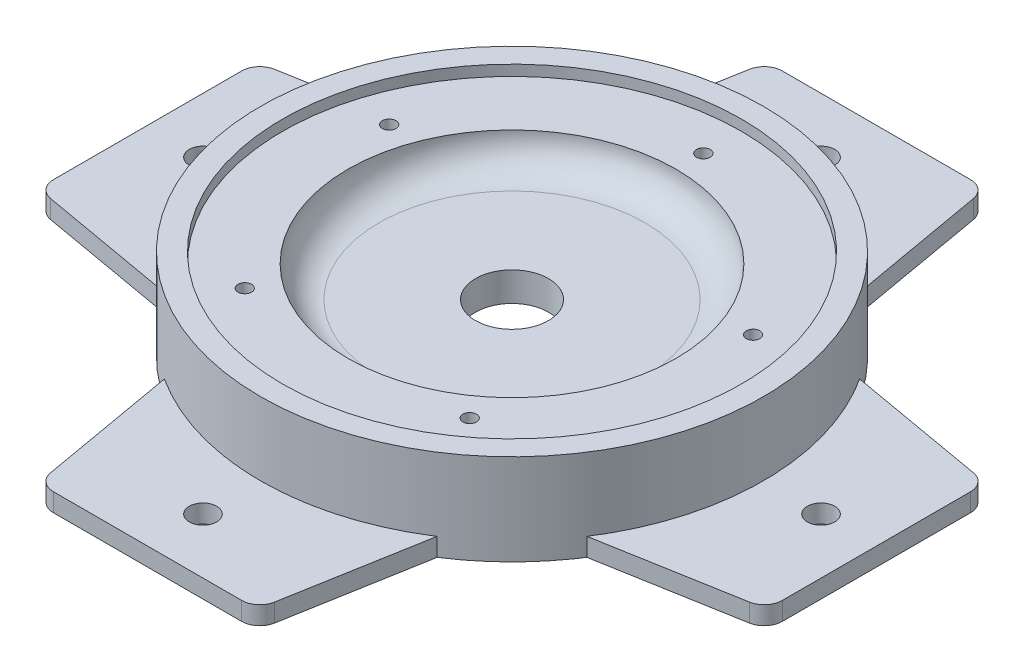
from build123d import *

# Parameters (mm, degrees)
F_3_16_0_187_DIAMETER_HOLE1_AT_2_COUNT = 2
F_3_16_0_187_DIAMETER_HOLE1_AT_2_PITCH = 181.676687383
CIRPATTERN2_COUNT                      = 5
F_1_1_DIAMETER_HOLE1_D                 = 25.4
BOSS_EXTRUDE1_DEPTH                    = 6.35
FILLET2_R                              = 6.35
CIRPATTERN4_COUNT                      = 4
FILLET3_R                              = 10.795


with BuildPart() as part:
    # Sketch1 → Revolve1 (revolve)
    with BuildSketch(Plane.XY, mode=Mode.PRIVATE) as revolve1_sk:
        Polygon((87.63, -7.0866), (87.63, 24.6634), (79.9846, 24.6634), (79.9846, 20.955), (57.15, 20.955), (57.15, 10.16), (0, 10.16), (0, 0), (57.15, 0), (57.15, -7.0866), align=None)
    revolve(revolve1_sk.sketch.rotate(Axis((0, 92.596818824, 0), (0, -1, 0)), 90), axis=Axis((0, 92.596818824, 0), (0, -1, 0)))

    # Sketch6 → 3/16 (0.187) Diameter Hole1 (revolve, cut)
    with BuildSketch(Plane(origin=(0, 24.6634, -66.675), x_dir=(0, 0, 1), z_dir=(1, 0, 0))):
        Polygon((0, 0), (0, 11.078983884), (2.3749, 9.652), (2.3749, 0), align=None)
    f_3_16_0_187_diameter_hole1 = revolve(axis=Axis((0, 31.0134, -66.675), (0, -1, 0)), mode=Mode.SUBTRACT)

    # 3/16 (0.187) Diameter Hole1 at 2: 3/16 (0.187) Diameter Hole1 ×2
    with Locations(*[Vector(-0.6277965872660483, 0, 0.778377443800309) * (i * F_3_16_0_187_DIAMETER_HOLE1_AT_2_PITCH) for i in range(1, F_3_16_0_187_DIAMETER_HOLE1_AT_2_COUNT)]):
        add(f_3_16_0_187_diameter_hole1, mode=Mode.SUBTRACT)

    # CirPattern2: 3/16 (0.187) Diameter Hole1 ×5 about axis
    cirpattern2_axis = Axis((0, 0, 0), (0, 1, 0))
    for i in range(1, CIRPATTERN2_COUNT):
        add(f_3_16_0_187_diameter_hole1.rotate(cirpattern2_axis, i * 360 / CIRPATTERN2_COUNT), mode=Mode.SUBTRACT)

    # CirPattern2 copy 1 sketch → CirPattern2 copy 1 (revolve, cut)
    with BuildSketch(Plane(origin=(35.834852053, 24.6634, 131.569029239), x_dir=(0.9510565162951535, 0, 0.30901699437494745), z_dir=(0.30901699437494745, 0, -0.9510565162951535))):
        Polygon((0, 0), (0, 11.078983884), (2.3749, 9.652), (2.3749, 0), align=None)
    revolve(axis=Axis((35.834852053, 31.0134, 131.569029239), (0, -1, 0)), mode=Mode.SUBTRACT)

    # CirPattern2 copy 2 sketch → CirPattern2 copy 2 (revolve, cut)
    with BuildSketch(Plane(origin=(136.203160876, 24.6634, 6.576096413), x_dir=(0.5877852522924732, 0, -0.8090169943749473), z_dir=(-0.8090169943749473, 0, -0.5877852522924732))):
        Polygon((0, 0), (0, 11.078983884), (2.3749, 9.652), (2.3749, 0), align=None)
    revolve(axis=Axis((136.203160876, 31.0134, 6.576096413), (0, -1, 0)), mode=Mode.SUBTRACT)

    # CirPattern2 copy 3 sketch → CirPattern2 copy 3 (revolve, cut)
    with BuildSketch(Plane(origin=(48.343330743, 24.6634, -127.504778142), x_dir=(-0.587785252292473, 0, -0.8090169943749476), z_dir=(-0.8090169943749476, 0, 0.587785252292473))):
        Polygon((0, 0), (0, 11.078983884), (2.3749, 9.652), (2.3749, 0), align=None)
    revolve(axis=Axis((48.343330743, 31.0134, -127.504778142), (0, -1, 0)), mode=Mode.SUBTRACT)

    # CirPattern2 copy 4 sketch → CirPattern2 copy 4 (revolve, cut)
    with BuildSketch(Plane(origin=(-106.325339347, 24.6634, -85.378383033), x_dir=(-0.9510565162951536, 0, 0.30901699437494723), z_dir=(0.30901699437494723, 0, 0.9510565162951536))):
        Polygon((0, 0), (0, 11.078983884), (2.3749, 9.652), (2.3749, 0), align=None)
    revolve(axis=Axis((-106.325339347, 31.0134, -85.378383033), (0, -1, 0)), mode=Mode.SUBTRACT)

    # 1 (1) Diameter Hole1 (through all)
    with Locations(Plane(origin=(0, 10.16, 0), x_dir=(1, 0, 0), z_dir=(0, 1, 0))):
        with Locations((0, 0)):
            Hole(F_1_1_DIAMETER_HOLE1_D / 2)

    # Fillet3
    # the kernel refuses this fillet: 10.795 mm, written as the material it adds along each edge
    with BuildSketch(Plane(origin=(0, 10.16, 0), x_dir=(0, 0, 1), z_dir=(1, 0, 0))) as fillet3_piece_1:
        with BuildLine():
            CenterArc((57.15 - FILLET3_R, -FILLET3_R), FILLET3_R, 0, 90)
            Line((57.15 - FILLET3_R, 0), (57.15 - FILLET3_R, FILLET3_R * 0.02))
            Line((57.15 - FILLET3_R, FILLET3_R * 0.02), (57.15 + FILLET3_R * 0.02, FILLET3_R * 0.02))
            Line((57.15 + FILLET3_R * 0.02, FILLET3_R * 0.02), (57.15 + FILLET3_R * 0.02, -FILLET3_R))
            Line((57.15 + FILLET3_R * 0.02, -FILLET3_R), (57.15, -FILLET3_R))
        make_face()
    revolve(axis=Axis((0, 10.16, 0), (0, -1, 0)))
    with BuildSketch(Plane(origin=(0, 0, 0), x_dir=(0, 0, 1), z_dir=(1, 0, 0))) as fillet3_piece_2:
        with BuildLine():
            CenterArc((47.011962989, 10.795), FILLET3_R, 270, 69.907948581)
            Line((47.011962989, 0), (47.011962989, -0.2159))
            Line((47.011962989, -0.2159), (57.15, -0.2159))
            Line((57.15, -0.2159), (57.3659, 0))
            ThreePointArc((57.3659, 0), (57.3659, 3.5433), (57.35276074, 7.012432))
            Line((57.35276074, 7.012432), (57.15, 7.0866))
        make_face()
    revolve(axis=Axis((0, 0, 0), (0, -1, 0)))


with BuildPart() as body_2:
    # Sketch15 → Boss-Extrude1 (new body)
    with BuildSketch(Plane.XZ.offset(7.0866)):
        with BuildLine():
            Line((-127, -38.1), (-73.632954963, -47.510049921))
            ThreePointArc((-73.632954963, -47.510049921), (-87.63, 0), (-73.632954963, 47.510049921))
            Line((-73.632954963, 47.510049921), (-127, 38.1))
            Line((-127, 38.1), (-127, -38.1))
        make_face()
    extrude(amount=-BOSS_EXTRUDE1_DEPTH)

    # Fillet2
    fillet2_edges = [body_2.edges().sort_by_distance(p)[0] for p in [
        (-127, -3.9116, 38.1),
        (-127, -3.9116, -38.1),
    ]]
    fillet(fillet2_edges, radius=FILLET2_R)

    # Sketch17 → 3/8 (0.375) Diameter Hole1 (revolve, cut)
    with BuildSketch(Plane(origin=(-107.696, -0.7366, 0), x_dir=(0, 0, 1), z_dir=(1, 0, 0))):
        Polygon((0, 0), (0, 28.261598698), (4.7625, 25.4), (4.7625, 0), align=None)
    revolve(axis=Axis((-107.696, 5.6134, 0), (0, -1, 0)), mode=Mode.SUBTRACT)


with BuildPart() as cirpattern4_1:
    # CirPattern4: pattern copy
    add(body_2.part.rotate(Axis((0, 0, 0), (0, 1, 0)), 1 * 360 / CIRPATTERN4_COUNT))


with BuildPart() as cirpattern4_2:
    # CirPattern4: pattern copy
    add(body_2.part.rotate(Axis((0, 0, 0), (0, 1, 0)), 2 * 360 / CIRPATTERN4_COUNT))


with BuildPart() as cirpattern4_3:
    # CirPattern4: pattern copy
    add(body_2.part.rotate(Axis((0, 0, 0), (0, 1, 0)), 3 * 360 / CIRPATTERN4_COUNT))


solid = Compound([part.part, body_2.part, cirpattern4_1.part, cirpattern4_2.part, cirpattern4_3.part])
